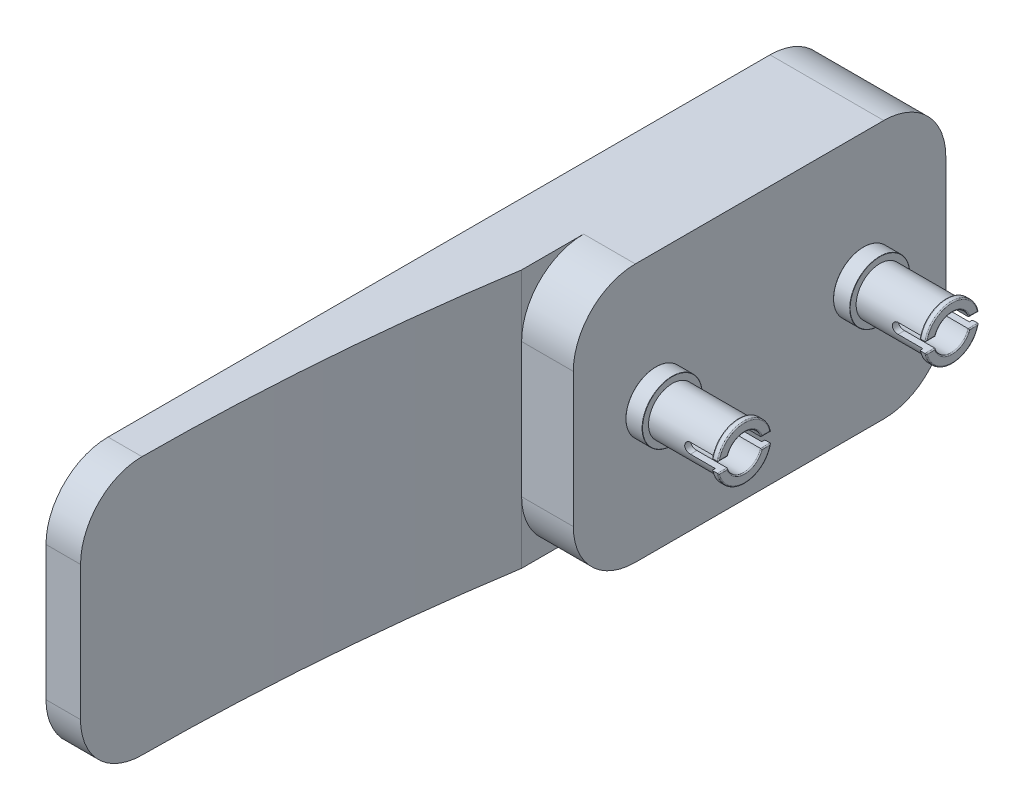
from build123d import *

# Parameters (mm, degrees)
CUT_EXTRUDE1_DEPTH      = 9.812491135
CUT_EXTRUDE1_DEPTH_BACK = 9.812491135
FILLET3_R               = 0.1
FILLET5_R               = 0.025
FILLET7_R               = 0.1
SKETCH5_W               = 23.845990582
SKETCH5_H               = 25
BOSS_EXTRUDE2_DEPTH     = 5
SKETCH6_W               = 36.024194174
SKETCH6_H               = 25
CUT_EXTRUDE3_DEPTH      = 5
FILLET8_R               = 6
BOSS_EXTRUDE3_START     = 6
BOSS_EXTRUDE3_DEPTH     = 6
CUT_EXTRUDE4_DEPTH      = 74.452895913


with BuildPart() as part:
    # Sketch1 → Revolve1 (revolve)
    with BuildSketch(Plane.XY):
        Polygon((0, 1.7), (0, 2.9), (-0.8, 2.9), (-0.8, 2.3), (-7.2, 2.3), (-7.2, 2.6), (-7.8, 2.6), (-7.8, 1.7), align=None)
    revolve(axis=Axis((0, 0, 0), (-1, 0, 0)))

    # Sketch2 → Cut-Extrude1 (cut, two sides: drawn at the far end of the back side and taken through both)
    with BuildSketch(Plane.XY.offset(-CUT_EXTRUDE1_DEPTH_BACK)):
        with BuildLine():
            Line((-7.8, 0.5), (-4.8, 0.5))
            ThreePointArc((-4.8, 0.5), (-4.3, 0), (-4.8, -0.5))
            Line((-4.8, -0.5), (-7.8, -0.5))
            Line((-7.8, -0.5), (-7.8, 0.5))
        make_face()
    extrude(amount=CUT_EXTRUDE1_DEPTH + CUT_EXTRUDE1_DEPTH_BACK, mode=Mode.SUBTRACT)

    # Fillet3
    fillet3_edges = [part.edges().sort_by_distance(p)[0] for p in [
        (-7.8, -1.7, 0),
        (-7.8, 1.367479433, 1.009950494),
        (-7.8, -2.6, 0),
        (-7.8, 2.6, 0),
        (-7.8, -0.5, -2.088138923),
        (-7.8, 0.5, 2.088138923),
        (-7.8, -0.5, 2.088138923),
        (-7.8, 0.5, -2.088138923),
    ]]
    fillet(fillet3_edges, radius=FILLET3_R - 0.0001)  # a hair under: the kernel refuses the full size

    # Fillet5
    fillet5_edges = [part.edges().sort_by_distance(p)[0] for p in [
        (-0.8, -2.9, 0),
    ]]
    fillet(fillet5_edges, radius=FILLET5_R)

    # Fillet7
    fillet7_edges = [part.edges().sort_by_distance(p)[0] for p in [
        (-7.2, -2.6, 0),
        (-7.2, 2.6, 0),
    ]]
    fillet(fillet7_edges, radius=FILLET7_R)

    # Mirror1: part across plane


with BuildPart() as part_1:
    add(part.part)
    add(part.part.mirror(Plane(origin=(0, 1.7, 0), x_dir=(0, 0, 1), z_dir=(1, 0, 0))))

    # Sketch5 → Boss-Extrude2 (add)
    with BuildSketch(Plane.ZY.offset(0.8)):
        with Locations((3.950898204, 0)):
            Rectangle(SKETCH5_W, SKETCH5_H)
    extrude(amount=BOSS_EXTRUDE2_DEPTH)

    # Mirror3: part across plane


with BuildPart() as part_2:
    add(part_1.part)
    add(part_1.part.mirror(Plane.XY.offset(10.04)))

    # Sketch6 → Cut-Extrude3 (cut)
    with BuildSketch(Plane.ZY.offset(5.8)):
        with Locations((10.04, 0)):
            Rectangle(SKETCH6_W, SKETCH6_H)
    extrude(amount=CUT_EXTRUDE3_DEPTH, mode=Mode.SUBTRACT)

    # Fillet8
    fillet8_edges = [part_2.edges().sort_by_distance(p)[0] for p in [
        (-3.3, 12.5, -7.972097087),
        (-3.3, -12.5, -7.972097087),
        (-3.3, 12.5, 28.052097087),
        (-3.3, -12.5, 28.052097087),
    ]]
    fillet(fillet8_edges, radius=FILLET8_R)

    # Sketch7 → Boss-Extrude3 (add)
    with BuildSketch(Plane.ZY.offset(5.8).offset(BOSS_EXTRUDE3_START)):
        with BuildLine():
            Line((22.052097087, 12.5), (62.052097087, 12.5))
            ThreePointArc((62.052097087, 12.5), (66.294737775, 10.742640687), (68.052097087, 6.5))
            Line((68.052097087, 6.5), (68.052097087, -6.5))
            ThreePointArc((68.052097087, -6.5), (66.294737775, -10.742640687), (62.052097087, -12.5))
            Line((62.052097087, -12.5), (22.052097087, -12.5))
            Line((22.052097087, -12.5), (-1.972097087, -12.5))
            ThreePointArc((-1.972097087, -12.5), (-6.214737775, -10.742640687), (-7.972097087, -6.5))
            Line((-7.972097087, -6.5), (-7.972097087, 6.5))
            ThreePointArc((-7.972097087, 6.5), (-6.214737775, 10.742640687), (-1.972097087, 12.5))
            Line((-1.972097087, 12.5), (22.052097087, 12.5))
        make_face()
    extrude(amount=-BOSS_EXTRUDE3_DEPTH)

    # Sketch8 → Cut-Extrude4 (cut, through all)
    with BuildSketch(Plane(origin=(0, 12.5, 0), x_dir=(1, 0, 0), z_dir=(0, 1, 0))):
        with BuildLine():
            Line((-8.457488517, -68.052097087), (-5.8, -68.052097087))
            Line((-5.8, -68.052097087), (-5.8, -28.052097087))
            add(Edge.make_bspline(
                [(-5.8, -28.052097087), (-8.917860213, -47.919752711), (-8.457488517, -68.052097087)],
                knots=[0, 0, 0, 1, 1, 1], degree=2))
        make_face()
    extrude(amount=-CUT_EXTRUDE4_DEPTH, mode=Mode.SUBTRACT)


solid = part_2.part
